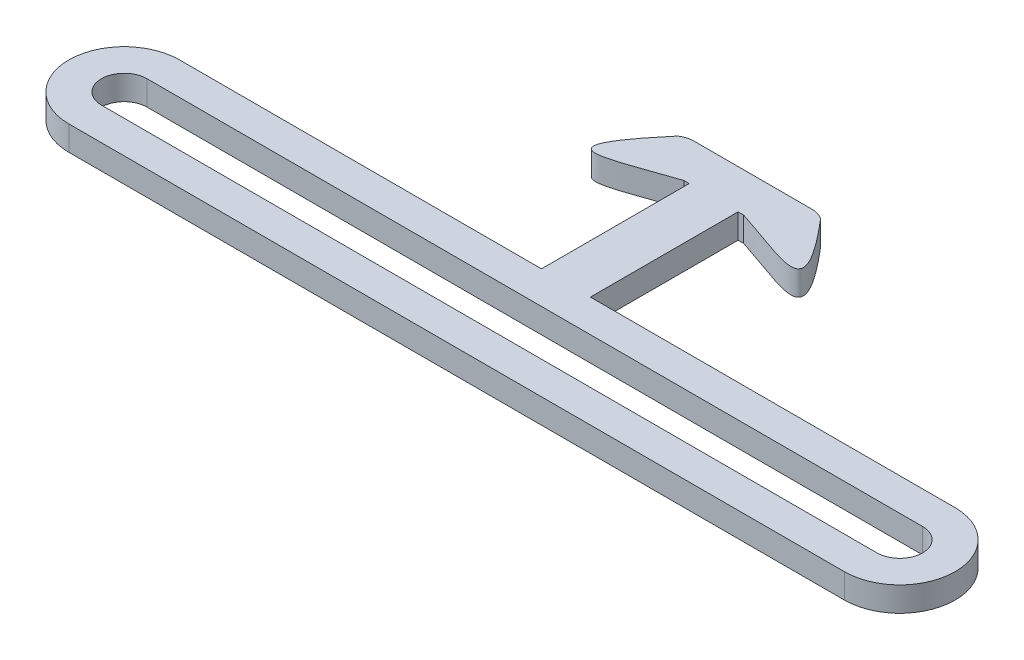
from build123d import *

# Parameters (mm, degrees)
BOSS_EXTRUDE3_DEPTH = 2.54


with BuildPart() as part:
    # Sketch1 → Boss-Extrude3 (new body)
    with BuildSketch(Plane(origin=(0, 0, 0), x_dir=(1, 0, 0), z_dir=(0, 1, 0))):
        with BuildLine():
            Line((-31.894408547, 18.754690562), (5.45779307, 18.754690562))
            Line((5.45779307, 18.754690562), (5.45779307, 34.000906254))
            Line((5.45779307, 34.000906254), (4.901566165, 34.000905893))
            add(Edge.make_bspline(
                [(0.612852457, 37.653470857), (-5.884627201, 30.033921709), (-1.443848449, 31.804516118), (4.158423813, 33.766425845), (4.901566165, 34.000905893)],
                knots=[0, 0, 0, 0, 0.594260847, 0.687271602, 0.687271602, 0.687271602, 0.687271602], degree=3))
            ThreePointArc((0.612852457, 37.653470857), (1.239882377, 37.946535066), (1.924681604, 38.047049587))
            Line((1.924681604, 38.047049587), (14.060170151, 38.047049587))
            ThreePointArc((14.060170151, 38.047049587), (14.744969378, 37.946535066), (15.371999297, 37.653470857))
            add(Edge.make_bspline(
                [(15.371999297, 37.653470857), (21.934906425, 29.957142832), (17.456126433, 31.784430539), (11.82548726, 33.766657758), (11.086684478, 34.000906254)],
                knots=[0, 0, 0, 0, 0.596031216, 0.688115304, 0.688115304, 0.688115304, 0.688115304], degree=3))
            Line((11.086684478, 34.000906254), (10.507756308, 34.000906254))
            Line((10.507756308, 34.000906254), (10.507756308, 18.754690562))
            Line((10.507756308, 18.754690562), (48.163481181, 18.754690562))
            ThreePointArc((48.163481181, 18.754690562), (53.88203624, 13.036135503), (48.163481181, 7.317580443))
            Line((48.163481181, 7.317580443), (-31.894408547, 7.317580443))
            ThreePointArc((-31.894408547, 7.317580443), (-37.612963606, 13.036135503), (-31.894408547, 18.754690562))
        make_face()
        with BuildLine():
            Line((-31.894408547, 15.393785396), (48.163481181, 15.393785396))
            ThreePointArc((48.163481181, 15.393785396), (50.521131074, 13.036135503), (48.163481181, 10.67848561))
            Line((48.163481181, 10.67848561), (-31.894408547, 10.67848561))
            ThreePointArc((-31.894408547, 10.67848561), (-34.252058439, 13.036135503), (-31.894408547, 15.393785396))
        make_face(mode=Mode.SUBTRACT)
    extrude(amount=BOSS_EXTRUDE3_DEPTH)


solid = part.part
